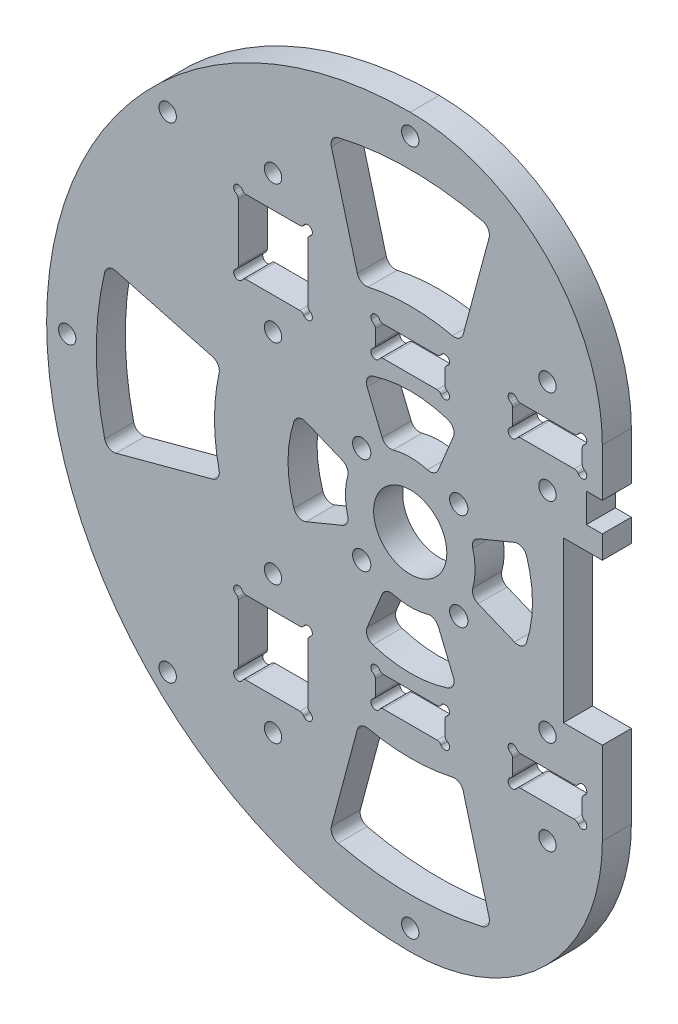
from build123d import *

# Parameters (mm, degrees)
SKETCH1_R                = 79.5
SKETCH1_R_2              = 1.9939
SKETCH1_R_3              = 1.89865
SKETCH1_R_4              = 8
BOSS_EXTRUDE1_DEPTH      = 6.35
SKETCH5_W                = 15.2
SKETCH5_H                = 16.075
CUT_EXTRUDE4_DEPTH       = 113.609158153
SKETCH6_R                = 1
CUT_EXTRUDE5_DEPTH       = 113.609158153
FILLET1_R                = 1
SKETCH10_W               = 53.523609979
SKETCH10_H               = 37.243469735
SKETCH10_W_2             = 54.285324016
SKETCH10_H_2             = 37.23416744
BOSS_EXTRUDE2_DEPTH      = 6.35
SKETCH11_W               = 15.2
SKETCH11_H               = 6.55
CUT_EXTRUDE8_DEPTH       = 113.609158153
SKETCH13_R               = 1
CUT_EXTRUDE9_DEPTH       = 113.609158153
FILLET2_R                = 1
LPATTERN3_COUNT          = 2
LPATTERN3_PITCH          = 30
FILLET2_OF_LPATTERN3_R   = 1
MIRROR3_DEPTH            = 6.35
CUT_EXTRUDE11_DEPTH      = 113.609158153
SKETCH15_W               = 6.35
SKETCH15_H               = 80
CUT_EXTRUDE12_DEPTH      = 113.609158153
CUT_EXTRUDE14_DEPTH      = 113.609158153
SKETCH17_R               = 1.89865
CUT_EXTRUDE15_DEPTH      = 113.609158153
CUT_EXTRUDE19_DEPTH      = 113.609158153
FILLET4_R                = 2
CIRPATTERN1_COUNT        = 4
FILLET4_OF_CIRPATTERN1_R = 2
CUT_EXTRUDE20_DEPTH      = 113.609158153
FILLET5_R                = 2
CIRPATTERN2_COUNT        = 4
FILLET5_OF_CIRPATTERN2_R = 2


# Read off the part's stored shape, not the designer's step: Mirror3
with BuildPart() as part:
    # Sketch1 → Boss-Extrude1 (new body)
    with BuildSketch(Plane.XY):
        Circle(SKETCH1_R)
        with Locations((74.714602357, -6.536680706)):
            Circle(SKETCH1_R_2, mode=Mode.SUBTRACT)
        with Locations((72.444436972, 19.411428383)):
            Circle(SKETCH1_R_3, mode=Mode.SUBTRACT)
        Circle(SKETCH1_R_4, mode=Mode.SUBTRACT)
        with Locations((67.973084028, -31.696369631)):
            Circle(SKETCH1_R_2, mode=Mode.SUBTRACT)
        with Locations((10.606601718, -10.606601718)):
            Circle(SKETCH1_R_2, mode=Mode.SUBTRACT)
        with Locations((0, -75)):
            Circle(SKETCH1_R_3, mode=Mode.SUBTRACT)
        with Locations((-10.606601718, -10.606601718)):
            Circle(SKETCH1_R_2, mode=Mode.SUBTRACT)
        with Locations((-10.606601718, 10.606601718)):
            Circle(SKETCH1_R_2, mode=Mode.SUBTRACT)
        with Locations((10.606601718, 10.606601718)):
            Circle(SKETCH1_R_2, mode=Mode.SUBTRACT)
        with Locations((-53.033008589, -53.033008589)):
            Circle(SKETCH1_R_3, mode=Mode.SUBTRACT)
        with Locations((-75, 0)):
            Circle(SKETCH1_R_3, mode=Mode.SUBTRACT)
        with Locations((-53.033008589, 53.033008589)):
            Circle(SKETCH1_R_3, mode=Mode.SUBTRACT)
        with Locations((0, 75)):
            Circle(SKETCH1_R_3, mode=Mode.SUBTRACT)
        with Locations((53.033008589, -53.033008589)):
            Circle(SKETCH1_R_3, mode=Mode.SUBTRACT)
    extrude(amount=BOSS_EXTRUDE1_DEPTH)

    # Sketch5 → Cut-Extrude4 (cut, through all)
    with BuildSketch(Plane.XY.offset(6.35)):
        with Locations((-30, -37.9375)):
            Rectangle(SKETCH5_W, SKETCH5_H)
        with Locations((-30, 37.9375)):
            Rectangle(SKETCH5_W, SKETCH5_H)
        with Locations((30, 37.9375)):
            Rectangle(SKETCH5_W, SKETCH5_H)
        with Locations((0, -37.9375)):
            Rectangle(SKETCH5_W, SKETCH5_H)
        with Locations((30, -37.9375)):
            Rectangle(SKETCH5_W, SKETCH5_H)
        with Locations((0, 37.9375)):
            Rectangle(SKETCH5_W, SKETCH5_H)
    extrude(amount=-CUT_EXTRUDE4_DEPTH, mode=Mode.SUBTRACT)

    # Sketch6 → Cut-Extrude5 (cut, through all)
    with BuildSketch(Plane.XY.offset(6.35)):
        with Locations((-37.6, 45.975)):
            Circle(SKETCH6_R)
        with Locations((-22.4, 45.975)):
            Circle(SKETCH6_R)
        with Locations((-37.6, 29.9)):
            Circle(SKETCH6_R)
        with Locations((-22.4, 29.9)):
            Circle(SKETCH6_R)
        with Locations((-7.6, 45.975)):
            Circle(SKETCH6_R)
        with Locations((7.6, 45.975)):
            Circle(SKETCH6_R)
        with Locations((-7.6, 29.9)):
            Circle(SKETCH6_R)
        with Locations((7.6, 29.9)):
            Circle(SKETCH6_R)
        with Locations((22.4, 45.975)):
            Circle(SKETCH6_R)
        with Locations((37.6, 45.975)):
            Circle(SKETCH6_R)
        with Locations((22.4, 29.9)):
            Circle(SKETCH6_R)
        with Locations((37.6, 29.9)):
            Circle(SKETCH6_R)
        with Locations((-37.6, -29.9)):
            Circle(SKETCH6_R)
        with Locations((-22.4, -29.9)):
            Circle(SKETCH6_R)
        with Locations((-37.6, -45.975)):
            Circle(SKETCH6_R)
        with Locations((-22.4, -45.975)):
            Circle(SKETCH6_R)
        with Locations((-7.6, -29.9)):
            Circle(SKETCH6_R)
        with Locations((7.6, -29.9)):
            Circle(SKETCH6_R)
        with Locations((-7.6, -45.975)):
            Circle(SKETCH6_R)
        with Locations((7.6, -45.975)):
            Circle(SKETCH6_R)
        with Locations((22.4, -29.9)):
            Circle(SKETCH6_R)
        with Locations((37.6, -29.9)):
            Circle(SKETCH6_R)
        with Locations((22.4, -45.975)):
            Circle(SKETCH6_R)
        with Locations((37.6, -45.975)):
            Circle(SKETCH6_R)
    extrude(amount=-CUT_EXTRUDE5_DEPTH, mode=Mode.SUBTRACT)

    # Fillet1
    fillet1_edges = [part.edges().sort_by_distance(p)[0] for p in [
        (-37.6, 44.975, 3.175),
        (-36.6, 45.975, 3.175),
        (-22.4, 44.975, 3.175),
        (-23.4, 45.975, 3.175),
        (-37.6, 30.9, 3.175),
        (-36.6, 29.9, 3.175),
        (-23.4, 29.9, 3.175),
        (-22.4, 30.9, 3.175),
        (-7.6, 44.975, 3.175),
        (-6.6, 45.975, 3.175),
        (7.6, 44.975, 3.175),
        (6.6, 45.975, 3.175),
        (-7.6, 30.9, 3.175),
        (-6.6, 29.9, 3.175),
        (6.6, 29.9, 3.175),
        (7.6, 30.9, 3.175),
        (22.4, 44.975, 3.175),
        (23.4, 45.975, 3.175),
        (37.6, 44.975, 3.175),
        (36.6, 45.975, 3.175),
        (22.4, 30.9, 3.175),
        (23.4, 29.9, 3.175),
        (36.6, 29.9, 3.175),
        (37.6, 30.9, 3.175),
        (-36.6, -29.9, 3.175),
        (-37.6, -30.9, 3.175),
        (-22.4, -30.9, 3.175),
        (-23.4, -29.9, 3.175),
        (-36.6, -45.975, 3.175),
        (-37.6, -44.975, 3.175),
        (-23.4, -45.975, 3.175),
        (-22.4, -44.975, 3.175),
        (-6.6, -29.9, 3.175),
        (-7.6, -30.9, 3.175),
        (7.6, -30.9, 3.175),
        (6.6, -29.9, 3.175),
        (-6.6, -45.975, 3.175),
        (-7.6, -44.975, 3.175),
        (6.6, -45.975, 3.175),
        (7.6, -44.975, 3.175),
        (23.4, -29.9, 3.175),
        (22.4, -30.9, 3.175),
        (37.6, -30.9, 3.175),
        (36.6, -29.9, 3.175),
        (23.4, -45.975, 3.175),
        (22.4, -44.975, 3.175),
        (36.6, -45.975, 3.175),
        (37.6, -44.975, 3.175),
    ]]
    fillet(fillet1_edges, radius=FILLET1_R)

    # Sketch10 → Boss-Extrude2 (add, through all)
    with BuildSketch(Plane(origin=(0, 0, 0), x_dir=(-1, 0, 0), z_dir=(0, 0, -1))):
        with Locations((-13.786008458, 43.712822415)):
            Rectangle(SKETCH10_W, SKETCH10_H)
        with Locations((-15.177733449, -42.065637654)):
            Rectangle(SKETCH10_W_2, SKETCH10_H_2)
    extrude(amount=-BOSS_EXTRUDE2_DEPTH)

    # Sketch11 → Cut-Extrude8 (cut, through all)
    with BuildSketch(Plane(origin=(0, 0, 0), x_dir=(-1, 0, 0), z_dir=(0, 0, -1))):
        with Locations((0, 33.175)):
            Rectangle(SKETCH11_W, SKETCH11_H)
    cut_extrude8 = extrude(amount=-CUT_EXTRUDE8_DEPTH, mode=Mode.SUBTRACT)

    # Sketch13 → Cut-Extrude9 (cut, through all)
    with BuildSketch(Plane(origin=(0, 0, 0), x_dir=(-1, 0, 0), z_dir=(0, 0, -1))):
        with Locations((-7.6, 36.45)):
            Circle(SKETCH13_R)
        with Locations((-7.6, 29.9)):
            Circle(SKETCH13_R)
        with Locations((7.6, 29.9)):
            Circle(SKETCH13_R)
        with Locations((7.6, 36.45)):
            Circle(SKETCH13_R)
    cut_extrude9 = extrude(amount=-CUT_EXTRUDE9_DEPTH, mode=Mode.SUBTRACT)

    # Fillet2
    fillet2_edges = [part.edges().sort_by_distance(p)[0] for p in [
        (6.6, 36.45, 3.175),
        (7.6, 35.45, 3.175),
        (-6.6, 36.45, 3.175),
        (7.6, 30.9, 3.175),
        (-6.6, 29.9, 3.175),
        (6.6, 29.9, 3.175),
        (-7.6, 30.9, 3.175),
        (-7.6, 35.45, 3.175),
    ]]
    fillet(fillet2_edges, radius=FILLET2_R)

    # LPattern3: Cut-Extrude8, Cut-Extrude9 ×2
    with Locations(*[(i * LPATTERN3_PITCH, 0, 0) for i in range(1, LPATTERN3_COUNT)]):
        add(cut_extrude8, mode=Mode.SUBTRACT)
        add(cut_extrude9, mode=Mode.SUBTRACT)

    # Fillet2 of LPattern3
    fillet2_of_lpattern3_edges = [part.edges().sort_by_distance(p)[0] for p in [
        (36.6, 36.45, 3.175),
        (37.6, 35.45, 3.175),
        (23.4, 36.45, 3.175),
        (37.6, 30.9, 3.175),
        (23.4, 29.9, 3.175),
        (36.6, 29.9, 3.175),
        (22.4, 30.9, 3.175),
        (22.4, 35.45, 3.175),
    ]]
    fillet(fillet2_of_lpattern3_edges, radius=FILLET2_OF_LPATTERN3_R)

    # Mirror3 outline → Mirror3 (cut)
    with BuildSketch(Plane.XY):
        with BuildLine():
            Line((-5.867949192, -36.45), (5.867949192, -36.45))
            ThreePointArc((5.867949192, -36.45), (6.367949192, -36.583974596), (6.733974596, -36.95))
            ThreePointArc((6.733974596, -36.95), (8.307106781, -37.157106781), (8.1, -35.583974596))
            ThreePointArc((8.1, -35.583974596), (7.733974596, -35.217949192), (7.6, -34.717949192))
            Line((7.6, -34.717949192), (7.6, -31.632050808))
            ThreePointArc((7.6, -31.632050808), (7.733974596, -31.132050808), (8.1, -30.766025404))
            ThreePointArc((8.1, -30.766025404), (8.307106781, -29.192893219), (6.733974596, -29.4))
            ThreePointArc((6.733974596, -29.4), (6.367949192, -29.766025404), (5.867949192, -29.9))
            Line((5.867949192, -29.9), (-5.867949192, -29.9))
            ThreePointArc((-5.867949192, -29.9), (-6.367949192, -29.766025404), (-6.733974596, -29.4))
            ThreePointArc((-6.733974596, -29.4), (-8.307106781, -29.192893219), (-8.1, -30.766025404))
            ThreePointArc((-8.1, -30.766025404), (-7.733974596, -31.132050808), (-7.6, -31.632050808))
            Line((-7.6, -31.632050808), (-7.6, -34.717949192))
            ThreePointArc((-7.6, -34.717949192), (-7.733974596, -35.217949192), (-8.1, -35.583974596))
            ThreePointArc((-8.1, -35.583974596), (-8.307106781, -37.157106781), (-6.733974596, -36.95))
            ThreePointArc((-6.733974596, -36.95), (-6.367949192, -36.583974596), (-5.867949192, -36.45))
        make_face()
        with BuildLine():
            Line((24.132050808, -36.45), (35.867949192, -36.45))
            ThreePointArc((35.867949192, -36.45), (36.367949192, -36.583974596), (36.733974596, -36.95))
            ThreePointArc((36.733974596, -36.95), (38.307106781, -37.157106781), (38.1, -35.583974596))
            ThreePointArc((38.1, -35.583974596), (37.733974596, -35.217949192), (37.6, -34.717949192))
            Line((37.6, -34.717949192), (37.6, -31.632050808))
            ThreePointArc((37.6, -31.632050808), (37.733974596, -31.132050808), (38.1, -30.766025404))
            ThreePointArc((38.1, -30.766025404), (38.307106781, -29.192893219), (36.733974596, -29.4))
            ThreePointArc((36.733974596, -29.4), (36.367949192, -29.766025404), (35.867949192, -29.9))
            Line((35.867949192, -29.9), (24.132050808, -29.9))
            ThreePointArc((24.132050808, -29.9), (23.632050808, -29.766025404), (23.266025404, -29.4))
            ThreePointArc((23.266025404, -29.4), (21.692893219, -29.192893219), (21.9, -30.766025404))
            ThreePointArc((21.9, -30.766025404), (22.266025404, -31.132050808), (22.4, -31.632050808))
            Line((22.4, -31.632050808), (22.4, -34.717949192))
            ThreePointArc((22.4, -34.717949192), (22.266025404, -35.217949192), (21.9, -35.583974596))
            ThreePointArc((21.9, -35.583974596), (21.692893219, -37.157106781), (23.266025404, -36.95))
            ThreePointArc((23.266025404, -36.95), (23.632050808, -36.583974596), (24.132050808, -36.45))
        make_face()
    extrude(amount=MIRROR3_DEPTH, mode=Mode.SUBTRACT)

    # Sketch14 → Cut-Extrude11 (cut, through all)
    with BuildSketch(Plane.XY):
        Polygon((33.5, -19.35), (62, -19.35), (62, 20.65), (65.5, 20.65), (65.5, 27), (62, 27), (62, 42), (42, 42), (42, 27), (38.5, 27), (38.5, 20.65), (42, 20.65), (42, 15.65), (33.5, 15.65), align=None)
    extrude(amount=CUT_EXTRUDE11_DEPTH, mode=Mode.SUBTRACT)

    # Sketch15 → Cut-Extrude12 (cut, through all)
    with BuildSketch(Plane.XY.offset(6.35)):
        with Locations((52, 42)):
            Rectangle(SKETCH15_W, SKETCH15_H)
    extrude(amount=-CUT_EXTRUDE12_DEPTH, mode=Mode.SUBTRACT)

    # Sketch16 → Cut-Extrude14 (cut, through all)
    with BuildSketch(Plane.XY):
        with BuildLine():
            Line((42, -37.5), (42, -14.02059918))
            Line((42, -14.02059918), (45.175, -14.029540215))
            Line((45.175, -14.029540215), (45.175, -79.5))
            Line((45.175, -79.5), (0, -79.5))
            ThreePointArc((0, -79.5), (29.69848481, -67.19848481), (42, -37.5))
        make_face()
        with BuildLine():
            Line((0, 79.5), (45.175, 79.5))
            Line((45.175, 79.5), (45.175, 14.029540215))
            Line((45.175, 14.029540215), (42, 14.02059918))
            Line((42, 14.02059918), (42, 37.5))
            ThreePointArc((42, 37.5), (29.69848481, 67.19848481), (0, 79.5))
        make_face()
    extrude(amount=CUT_EXTRUDE14_DEPTH, mode=Mode.SUBTRACT)


with BuildPart() as cut_extrude14_kept_piece:
    # of the separate pieces the step leaves, the one the design keeps (cut_extrude14_pieces_kept)
    add(part.part.solids().sort_by_distance((0, 79.5, 6.35))[0])

    # Sketch17 → Cut-Extrude15 (cut, through all)
    with BuildSketch(Plane.XY.offset(6.35)):
        with Locations((-30, 52.975)):
            Circle(SKETCH17_R)
        with Locations((-30, 22.9)):
            Circle(SKETCH17_R)
        with Locations((30, 22.9)):
            Circle(SKETCH17_R)
        with Locations((30, 43.45)):
            Circle(SKETCH17_R)
    cut_extrude15 = extrude(amount=-CUT_EXTRUDE15_DEPTH, mode=Mode.SUBTRACT)

    # Mirror4: Cut-Extrude15 across plane
    add(cut_extrude15.mirror(Plane.ZX), mode=Mode.SUBTRACT)

    # Sketch25 → Cut-Extrude19 (cut, through all)
    with BuildSketch(Plane.XY.offset(6.35)):
        with BuildLine():
            Line((-10.22721473, -24.690680506), (-5.424537654, -13.095992373))
            ThreePointArc((-5.424537654, -13.095992373), (0, -14.175), (5.424537654, -13.095992373))
            Line((5.424537654, -13.095992373), (10.22721473, -24.690680506))
            ThreePointArc((10.22721473, -24.690680506), (0, -26.725), (-10.22721473, -24.690680506))
        make_face()
    cut_extrude19 = extrude(amount=-CUT_EXTRUDE19_DEPTH, mode=Mode.SUBTRACT)

    # Fillet4
    fillet4_edges = [cut_extrude14_kept_piece.edges().sort_by_distance(p)[0] for p in [
        (-5.424537654, -13.095992373, 3.175),
        (5.424537654, -13.095992373, 3.175),
        (10.22721473, -24.690680506, 3.175),
        (-10.22721473, -24.690680506, 3.175),
    ]]
    fillet(fillet4_edges, radius=FILLET4_R)

    # CirPattern1: Cut-Extrude19 ×4 about axis
    cirpattern1_axis = Axis((0, 0, 0), (0, 0, 1))
    for i in range(1, CIRPATTERN1_COUNT):
        add(cut_extrude19.rotate(cirpattern1_axis, i * 360 / CIRPATTERN1_COUNT), mode=Mode.SUBTRACT)

    # Fillet4 of CirPattern1
    fillet4_of_cirpattern1_edges = [cut_extrude14_kept_piece.edges().sort_by_distance(p)[0] for p in [
        (13.095992373, -5.424537654, 3.175),
        (13.095992373, 5.424537654, 3.175),
        (24.690680506, 10.22721473, 3.175),
        (24.690680506, -10.22721473, 3.175),
        (5.424537654, 13.095992373, 3.175),
        (-5.424537654, 13.095992373, 3.175),
        (-10.22721473, 24.690680506, 3.175),
        (10.22721473, 24.690680506, 3.175),
        (-13.095992373, 5.424537654, 3.175),
        (-13.095992373, -5.424537654, 3.175),
        (-24.690680506, -10.22721473, 3.175),
        (-24.690680506, 10.22721473, 3.175),
    ]]
    fillet(fillet4_of_cirpattern1_edges, radius=FILLET4_OF_CIRPATTERN1_R)

    # Sketch26 → Cut-Extrude20 (cut, through all)
    with BuildSketch(Plane.XY.offset(6.35)):
        with BuildLine():
            Line((-17.767927446, -66.310807975), (-11.07745513, -41.341625365))
            ThreePointArc((-11.07745513, -41.341625365), (0, -42.8), (11.07745513, -41.341625365))
            Line((11.07745513, -41.341625365), (17.767927446, -66.310807975))
            ThreePointArc((17.767927446, -66.310807975), (0, -68.65), (-17.767927446, -66.310807975))
        make_face()
    cut_extrude20 = extrude(amount=-CUT_EXTRUDE20_DEPTH, mode=Mode.SUBTRACT)

    # Fillet5
    fillet5_edges = [cut_extrude14_kept_piece.edges().sort_by_distance(p)[0] for p in [
        (-11.07745513, -41.341625365, 3.175),
        (11.07745513, -41.341625365, 3.175),
        (17.767927446, -66.310807975, 3.175),
        (-17.767927446, -66.310807975, 3.175),
    ]]
    fillet(fillet5_edges, radius=FILLET5_R)

    # CirPattern2: Cut-Extrude20 ×4 about axis, 1 skipped
    cirpattern2_axis = Axis((0, 0, 0), (0, 0, -1))
    add([cut_extrude20.rotate(cirpattern2_axis, i * 360 / CIRPATTERN2_COUNT) for i in range(1, CIRPATTERN2_COUNT) if i not in (3,)], mode=Mode.SUBTRACT)

    # Fillet5 of CirPattern2
    fillet5_of_cirpattern2_edges = [cut_extrude14_kept_piece.edges().sort_by_distance(p)[0] for p in [
        (-41.341625365, 11.07745513, 3.175),
        (-41.341625365, -11.07745513, 3.175),
        (-66.310807975, -17.767927446, 3.175),
        (-66.310807975, 17.767927446, 3.175),
        (11.07745513, 41.341625365, 3.175),
        (-11.07745513, 41.341625365, 3.175),
        (-17.767927446, 66.310807975, 3.175),
        (17.767927446, 66.310807975, 3.175),
    ]]
    fillet(fillet5_of_cirpattern2_edges, radius=FILLET5_OF_CIRPATTERN2_R)


solid = cut_extrude14_kept_piece.part
